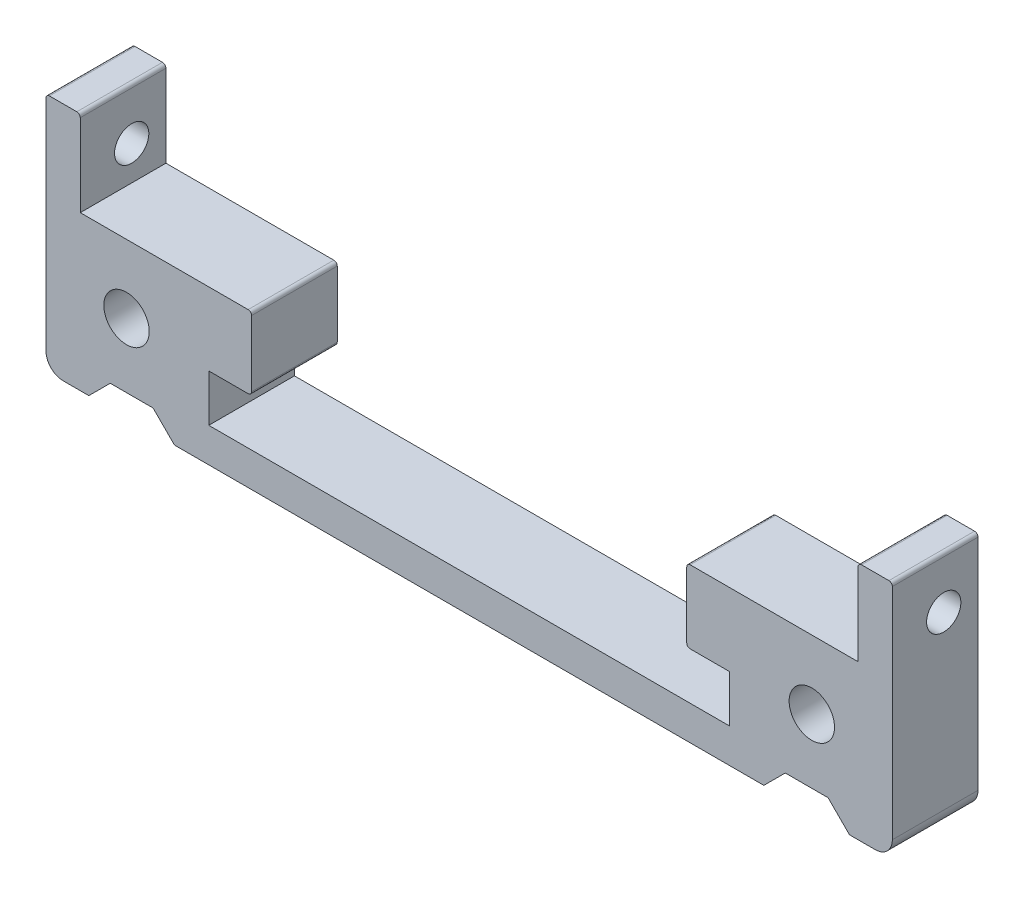
from build123d import *

# Parameters (mm, degrees)
SKETCH1_R           = 2.65
BOSS_EXTRUDE1_DEPTH = 10
CUT_EXTRUDE8_REACH  = 59.657
SKETCH10_R          = 2


with BuildPart() as part:
    # Sketch1 → Boss-Extrude1 (new body)
    with BuildSketch(Plane.XY):
        with BuildLine():
            Line((0, 0), (0, 4))
            Line((0, 4), (-30.4, 4))
            Line((-30.4, 4), (-30.4, 9.5))
            Line((-30.4, 9.5), (-25.8, 9.5))
            ThreePointArc((-25.8, 9.5), (-25.517157288, 9.617157288), (-25.4, 9.9))
            Line((-25.4, 9.9), (-25.4, 17.6))
            ThreePointArc((-25.4, 17.6), (-25.517157288, 17.882842712), (-25.8, 18))
            Line((-25.8, 18), (-45.4, 18))
            Line((-45.4, 18), (-45.4, 27.6))
            ThreePointArc((-45.4, 27.6), (-45.517157288, 27.882842712), (-45.8, 28))
            Line((-45.8, 28), (-49, 28))
            ThreePointArc((-49, 28), (-49.282842712, 27.882842712), (-49.4, 27.6))
            Line((-49.4, 27.6), (-49.4, 2))
            ThreePointArc((-49.4, 2), (-48.814213562, 0.585786438), (-47.4, 0))
            Line((-47.4, 0), (-44.4, 0))
            Line((-44.4, 0), (-41.9, 2.5))
            Line((-41.9, 2.5), (-36.9, 2.5))
            Line((-36.9, 2.5), (-34.4, 0))
            Line((-34.4, 0), (0, 0))
        make_face()
        with Locations((-40, 10)):
            Circle(SKETCH1_R, mode=Mode.SUBTRACT)
    boss_extrude1 = extrude(amount=BOSS_EXTRUDE1_DEPTH)

    # Sketch10 → Cut-Extrude8 (cut, up to next)
    with BuildSketch(Plane.ZY.offset(49.4), mode=Mode.PRIVATE) as cut_extrude8_sk1:
        with Locations((4, 22)):
            Circle(SKETCH10_R)
    cut_extrude8_tool1 = extrude(cut_extrude8_sk1.sketch, amount=-CUT_EXTRUDE8_REACH, mode=Mode.PRIVATE) & part.part
    cut_extrude8 = cut_extrude8_tool1.solids().sort_by_distance((-49.4, 22, 4))[0]
    add(cut_extrude8, mode=Mode.SUBTRACT)

    # Mirror1: Boss-Extrude1, Cut-Extrude8 across plane
    add(boss_extrude1.mirror(Plane(origin=(0, 0, 0), x_dir=(0, 0, 1), z_dir=(1, 0, 0))))
    add(cut_extrude8.mirror(Plane(origin=(0, 0, 0), x_dir=(0, 0, 1), z_dir=(1, 0, 0))), mode=Mode.SUBTRACT)


solid = part.part
